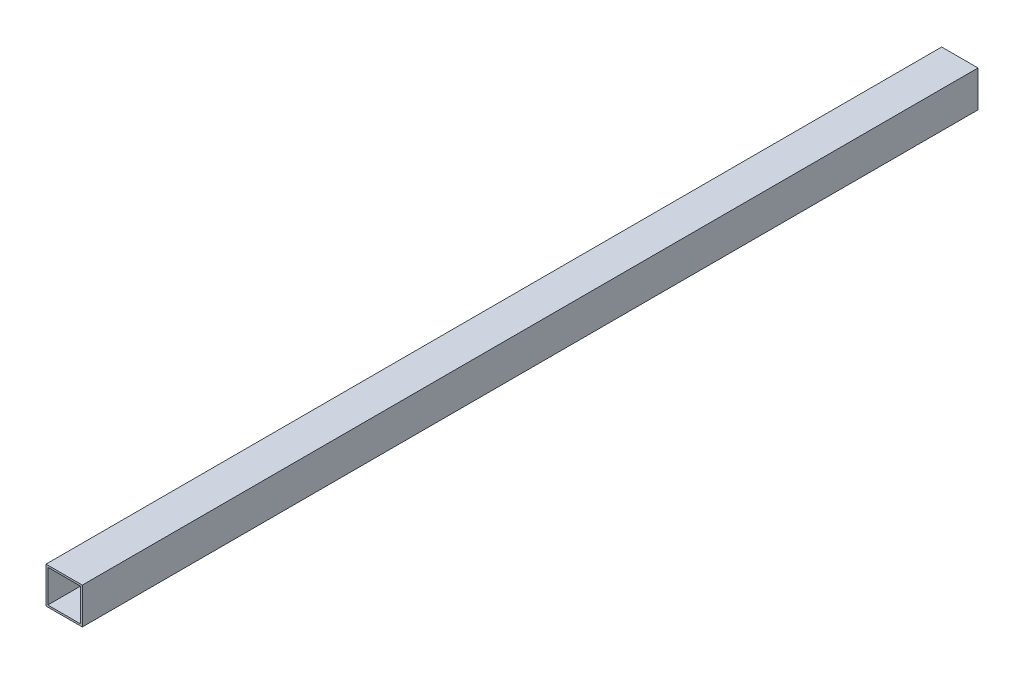
from build123d import *

# Parameters (mm, degrees)
SKETCH_1_W      = 20
SKETCH_1_H      = 20
SKETCH_1_W_2    = 18
SKETCH_1_H_2    = 18
EXTRUDE_1_DEPTH = 493.33


with BuildPart() as part:
    # 草图1 → 凸台-拉伸1 (new body)
    with BuildSketch(Plane.XY):
        Rectangle(SKETCH_1_W, SKETCH_1_H)
        Rectangle(SKETCH_1_W_2, SKETCH_1_H_2, mode=Mode.SUBTRACT)
    extrude(amount=EXTRUDE_1_DEPTH)


solid = part.part
